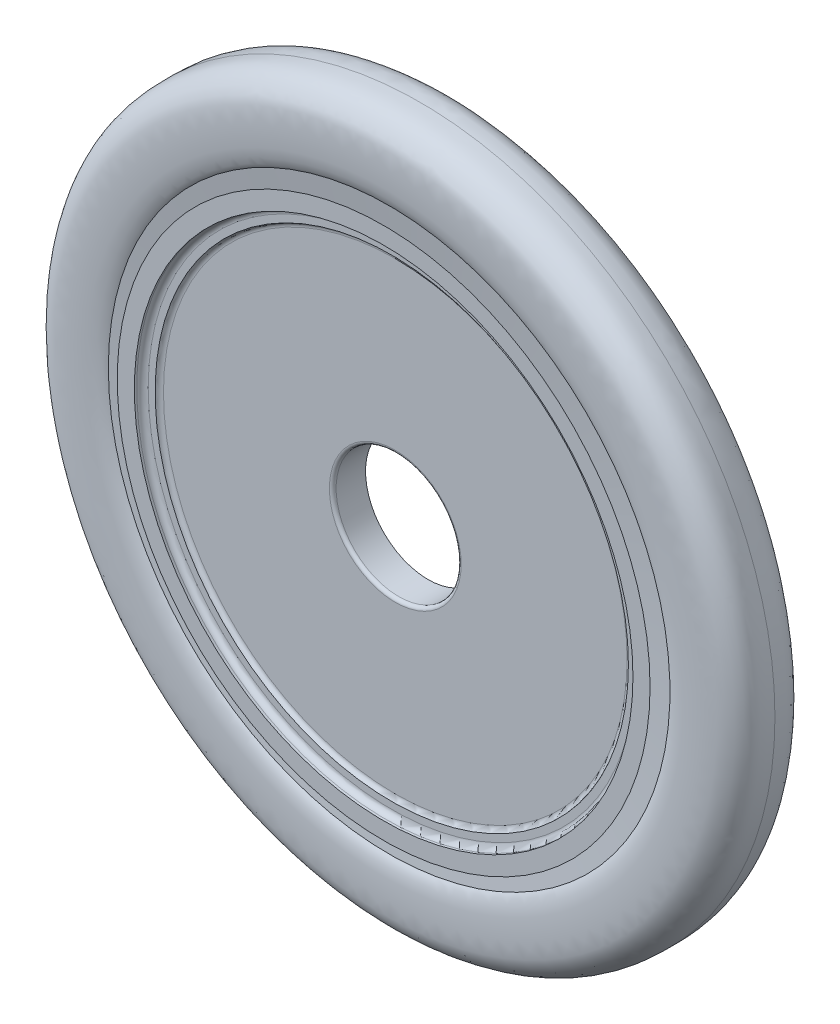
from build123d import *

# Parameters (mm, degrees)
SKETCH1_R                 = 279.4
EXTRUDE1_DEPTH            = 54.61
SKETCH2_R                 = 46.99
CUT_EXTRUDE1_DEPTH        = 399.887167129
SKETCH3_R                 = 187.325
CUT_EXTRUDE2_DEPTH        = 6.096
SKETCH4_R                 = 177.8
CUT_EXTRUDE3_DEPTH        = 2.6416
FILLET6_R                 = 3.81
FILLET7_R                 = 4.318
FILLET8_R                 = 2.54
CUT_EXTRUDE4_START        = -5.9944
SKETCH5_R                 = 187.325
CUT_EXTRUDE4_DEPTH        = 5.9944
FILLET9_R                 = 5.08
SKETCH6_R                 = 176.2125
CUT_EXTRUDE5_DEPTH        = 9.3218
FILLET10_R                = 6.35
SKETCH7_R                 = 76.2
CUT_EXTRUDE6_DEPTH        = 397.538334434
CUT_EXTRUDE7_REACH        = 399.584
SKETCH10_R                = 159.930520618
SKETCH10_R_2              = 68.9991
CUT_EXTRUDE8_DEPTH        = 3.3528
SKETCH15_W                = 18.9992
SKETCH15_H                = 48.261175693
SKETCH15_H_2              = 43.875151213
CUT_EXTRUDE9_DEPTH        = 44.0944
FILLET11_R                = 6.35
CIRPATTERN2_COUNT         = 6
FILLET11_OF_CIRPATTERN2_R = 6.35
SKETCH16_R                = 4.7625
CUT_EXTRUDE10_DEPTH       = 22.86
FILLET12_R                = 6.35
CIRPATTERN3_COUNT         = 6
FILLET12_OF_CIRPATTERN3_R = 6.35


with BuildPart() as part:
    # Sketch1 → Extrude1 (new body)
    with BuildSketch(Plane.XY):
        Circle(SKETCH1_R)
    extrude(amount=EXTRUDE1_DEPTH)

    # Sketch2 → Cut-Extrude1 (cut, through all)
    with BuildSketch(Plane.XY.offset(54.61)):
        Circle(SKETCH2_R)
    extrude(amount=-CUT_EXTRUDE1_DEPTH, mode=Mode.SUBTRACT)

    # Sketch3 → Cut-Extrude2 (cut)
    with BuildSketch(Plane.XY.offset(54.61)):
        Circle(SKETCH3_R)
    extrude(amount=-CUT_EXTRUDE2_DEPTH, mode=Mode.SUBTRACT)

    # Sketch4 → Cut-Extrude3 (cut)
    with BuildSketch(Plane.XY.offset(48.514)):
        Circle(SKETCH4_R)
    extrude(amount=-CUT_EXTRUDE3_DEPTH, mode=Mode.SUBTRACT)

    # Fillet6
    # the kernel refuses this fillet: 3.81 mm, written as the material it adds along each edge
    with BuildSketch(Plane(origin=(0, 0, 45.8724), x_dir=(1, 0, 0), z_dir=(0, -1, 0))) as fillet6_piece_1:
        with BuildLine():
            CenterArc((174.173577322, 3.81), FILLET6_R, 270, 72.141537302)
            Line((177.8, 2.6416), (177.872528454, 2.618232))
            ThreePointArc((177.872528454, 2.618232), (177.8762, 1.3208), (177.8762, 0))
            Line((177.8762, 0), (177.8, -0.0762))
            Line((177.8, -0.0762), (174.173577322, -0.0762))
            Line((174.173577322, -0.0762), (174.173577322, 0))
        make_face()
    revolve(axis=Axis((0, 0, 45.8724), (0, 0, 1)))

    # Fillet7
    fillet7_edges = [part.edges().sort_by_distance(p)[0] for p in [
        (-187.325, 0, 48.514),
    ]]
    fillet(fillet7_edges, radius=FILLET7_R)

    # Fillet8
    fillet8_edges = [part.edges().sort_by_distance(p)[0] for p in [
        (-46.99, 0, 45.8724),
    ]]
    fillet(fillet8_edges, radius=FILLET8_R)

    # Sketch5 → Cut-Extrude4 (cut)
    with BuildSketch(Plane(origin=(0, 0, 0), x_dir=(-1, 0, 0), z_dir=(0, 0, -1)).offset(CUT_EXTRUDE4_START)):
        with Locations(Location((0, 0, 0), (0, 0, 180))):
            Circle(SKETCH5_R)
    extrude(amount=CUT_EXTRUDE4_DEPTH, mode=Mode.SUBTRACT)

    # Fillet9
    fillet9_edges = [part.edges().sort_by_distance(p)[0] for p in [
        (-187.325, 0, 5.9944),
    ]]
    fillet(fillet9_edges, radius=FILLET9_R)

    # Sketch6 → Cut-Extrude5 (cut)
    with BuildSketch(Plane(origin=(0, 0, 5.9944), x_dir=(-1, 0, 0), z_dir=(0, 0, -1))):
        Circle(SKETCH6_R)
    extrude(amount=-CUT_EXTRUDE5_DEPTH, mode=Mode.SUBTRACT)

    # Fillet10
    fillet10_edges = [part.edges().sort_by_distance(p)[0] for p in [
        (176.2125, 0, 5.9944),
    ]]
    fillet(fillet10_edges, radius=FILLET10_R)

    # Sketch7 → Cut-Extrude6 (cut, through all)
    with BuildSketch(Plane.XY.offset(21.2344)):
        Circle(SKETCH7_R)
    extrude(amount=-CUT_EXTRUDE6_DEPTH, mode=Mode.SUBTRACT)

    # Sketch9 → Cut-Extrude7 (cut, up to next)
    with BuildSketch(Plane.XY.offset(44.0944), mode=Mode.PRIVATE) as cut_extrude7_sk1:
        with BuildLine():
            Line((-11.43, 74.173762619), (-11.43, 159.521555048))
            ThreePointArc((-11.43, 159.521555048), (-13.991378978, 165.220217467), (-19.953557312, 167.087794813))
            ThreePointArc((-19.953557312, 167.087794813), (-84.1375, 145.730424822), (-134.725496315, 100.824184935))
            ThreePointArc((-134.725496315, 100.824184935), (-136.089216056, 94.726998363), (-132.434719123, 89.659447889))
            Line((-132.434719123, 89.659447889), (-58.521362722, 46.985551675))
            ThreePointArc((-58.521362722, 46.985551675), (-53.67746857, 46.0351313), (-49.267446033, 48.252857764))
            ThreePointArc((-49.267446033, 48.252857764), (-34.4805, 59.72197787), (-17.154477612, 66.793288726))
            ThreePointArc((-17.154477612, 66.793288726), (-13.028858887, 69.503617043), (-11.43, 74.173762619))
        make_face()
    cut_extrude7_tool1 = extrude(cut_extrude7_sk1.sketch, amount=-CUT_EXTRUDE7_REACH, mode=Mode.PRIVATE) & part.part
    # Sketch9 → Cut-Extrude7 (cut, up to next)
    with BuildSketch(Plane.XY.offset(44.0944), mode=Mode.PRIVATE) as cut_extrude7_sk2:
        with BuildLine():
            Line((11.43, 74.173762619), (11.43, 159.521555048))
            ThreePointArc((11.43, 159.521555048), (13.991378978, 165.220217467), (19.953557312, 167.087794813))
            ThreePointArc((19.953557312, 167.087794813), (84.1375, 145.730424822), (134.725496315, 100.824184935))
            ThreePointArc((134.725496315, 100.824184935), (136.089216056, 94.726998363), (132.434719123, 89.659447889))
            Line((132.434719123, 89.659447889), (58.521362722, 46.985551675))
            ThreePointArc((58.521362722, 46.985551675), (53.67746857, 46.0351313), (49.267446033, 48.252857764))
            ThreePointArc((49.267446033, 48.252857764), (34.4805, 59.72197787), (17.154477612, 66.793288726))
            ThreePointArc((17.154477612, 66.793288726), (13.028858887, 69.503617043), (11.43, 74.173762619))
        make_face()
    cut_extrude7_tool2 = extrude(cut_extrude7_sk2.sketch, amount=-CUT_EXTRUDE7_REACH, mode=Mode.PRIVATE) & part.part
    # Sketch9 → Cut-Extrude7 (cut, up to next)
    with BuildSketch(Plane.XY.offset(44.0944), mode=Mode.PRIVATE) as cut_extrude7_sk3:
        with BuildLine():
            Line((69.951362722, 27.188210944), (143.864719123, 69.862107159))
            ThreePointArc((143.864719123, 69.862107159), (150.080595034, 70.493219104), (154.679053627, 66.263609878))
            ThreePointArc((154.679053627, 66.263609878), (168.275, 0), (154.679053627, -66.263609878))
            ThreePointArc((154.679053627, -66.263609878), (150.080595034, -70.493219104), (143.864719123, -69.862107159))
            Line((143.864719123, -69.862107159), (69.951362722, -27.188210944))
            ThreePointArc((69.951362722, -27.188210944), (66.706327457, -23.468485743), (66.421923645, -18.540430963))
            ThreePointArc((66.421923645, -18.540430963), (68.961, 0), (66.421923645, 18.540430963))
            ThreePointArc((66.421923645, 18.540430963), (66.706327457, 23.468485743), (69.951362722, 27.188210944))
        make_face()
    cut_extrude7_tool3 = extrude(cut_extrude7_sk3.sketch, amount=-CUT_EXTRUDE7_REACH, mode=Mode.PRIVATE) & part.part
    # Sketch9 → Cut-Extrude7 (cut, up to next)
    with BuildSketch(Plane.XY.offset(44.0944), mode=Mode.PRIVATE) as cut_extrude7_sk4:
        with BuildLine():
            Line((58.521362722, -46.985551675), (132.434719123, -89.659447889))
            ThreePointArc((132.434719123, -89.659447889), (136.089216056, -94.726998363), (134.725496315, -100.824184935))
            ThreePointArc((134.725496315, -100.824184935), (84.1375, -145.730424822), (19.953557312, -167.087794813))
            ThreePointArc((19.953557312, -167.087794813), (13.991378978, -165.220217467), (11.43, -159.521555048))
            Line((11.43, -159.521555048), (11.43, -74.173762619))
            ThreePointArc((11.43, -74.173762619), (13.028858887, -69.503617043), (17.154477612, -66.793288726))
            ThreePointArc((17.154477612, -66.793288726), (34.4805, -59.72197787), (49.267446033, -48.252857764))
            ThreePointArc((49.267446033, -48.252857764), (53.67746857, -46.0351313), (58.521362722, -46.985551675))
        make_face()
    cut_extrude7_tool4 = extrude(cut_extrude7_sk4.sketch, amount=-CUT_EXTRUDE7_REACH, mode=Mode.PRIVATE) & part.part
    # Sketch9 → Cut-Extrude7 (cut, up to next)
    with BuildSketch(Plane.XY.offset(44.0944), mode=Mode.PRIVATE) as cut_extrude7_sk5:
        with BuildLine():
            Line((-11.43, -74.173762619), (-11.43, -159.521555048))
            ThreePointArc((-11.43, -159.521555048), (-13.991378978, -165.220217467), (-19.953557312, -167.087794813))
            ThreePointArc((-19.953557312, -167.087794813), (-84.1375, -145.730424822), (-134.725496315, -100.824184935))
            ThreePointArc((-134.725496315, -100.824184935), (-136.089216056, -94.726998363), (-132.434719123, -89.659447889))
            Line((-132.434719123, -89.659447889), (-58.521362722, -46.985551675))
            ThreePointArc((-58.521362722, -46.985551675), (-53.67746857, -46.0351313), (-49.267446033, -48.252857764))
            ThreePointArc((-49.267446033, -48.252857764), (-34.4805, -59.72197787), (-17.154477612, -66.793288726))
            ThreePointArc((-17.154477612, -66.793288726), (-13.028858887, -69.503617043), (-11.43, -74.173762619))
        make_face()
    cut_extrude7_tool5 = extrude(cut_extrude7_sk5.sketch, amount=-CUT_EXTRUDE7_REACH, mode=Mode.PRIVATE) & part.part
    # Sketch9 → Cut-Extrude7 (cut, up to next)
    with BuildSketch(Plane.XY.offset(44.0944), mode=Mode.PRIVATE) as cut_extrude7_sk6:
        with BuildLine():
            Line((-69.951362722, -27.188210944), (-143.864719123, -69.862107159))
            ThreePointArc((-143.864719123, -69.862107159), (-150.080595034, -70.493219104), (-154.679053627, -66.263609878))
            ThreePointArc((-154.679053627, -66.263609878), (-168.275, 0), (-154.679053627, 66.263609878))
            ThreePointArc((-154.679053627, 66.263609878), (-150.080595034, 70.493219104), (-143.864719123, 69.862107159))
            Line((-143.864719123, 69.862107159), (-69.951362722, 27.188210944))
            ThreePointArc((-69.951362722, 27.188210944), (-66.706327457, 23.468485743), (-66.421923645, 18.540430963))
            ThreePointArc((-66.421923645, 18.540430963), (-68.961, 0), (-66.421923645, -18.540430963))
            ThreePointArc((-66.421923645, -18.540430963), (-66.706327457, -23.468485743), (-69.951362722, -27.188210944))
        make_face()
    cut_extrude7_tool6 = extrude(cut_extrude7_sk6.sketch, amount=-CUT_EXTRUDE7_REACH, mode=Mode.PRIVATE) & part.part
    add(cut_extrude7_tool1.solids().sort_by_distance((-61.581371, 106.662063, 44.0944))[0], mode=Mode.SUBTRACT)
    add(cut_extrude7_tool2.solids().sort_by_distance((61.581371, 106.662063, 44.0944))[0], mode=Mode.SUBTRACT)
    add(cut_extrude7_tool3.solids().sort_by_distance((123.162741, 0, 44.0944))[0], mode=Mode.SUBTRACT)
    add(cut_extrude7_tool4.solids().sort_by_distance((61.581371, -106.662063, 44.0944))[0], mode=Mode.SUBTRACT)
    add(cut_extrude7_tool5.solids().sort_by_distance((-61.581371, -106.662063, 44.0944))[0], mode=Mode.SUBTRACT)
    add(cut_extrude7_tool6.solids().sort_by_distance((-123.162741, 0, 44.0944))[0], mode=Mode.SUBTRACT)

    # Sketch10 → Cut-Extrude8 (cut)
    with BuildSketch(Plane(origin=(0, 0, 21.2344), x_dir=(-1, 0, 0), z_dir=(0, 0, -1))):
        Circle(SKETCH10_R)
        Circle(SKETCH10_R_2, mode=Mode.SUBTRACT)
    extrude(amount=-CUT_EXTRUDE8_DEPTH, mode=Mode.SUBTRACT)

    # Sketch13 → Cut-Revolve3 (revolve, cut)
    with BuildSketch(Plane(origin=(0, 0, 0), x_dir=(0, 0, -1), z_dir=(1, 0, 0)), mode=Mode.PRIVATE) as cut_revolve3_sk:
        Polygon((-24.5872, 68.9991), (-32.5628, 169.266397065), (37.50626542, 169.266397065), (37.50626542, 68.9991), align=None)
    revolve(cut_revolve3_sk.sketch.rotate(Axis((0, 0, -70), (0, 0, 1)), 90), axis=Axis((0, 0, -70), (0, 0, 1)), mode=Mode.SUBTRACT)

    # Sketch14 → Cut-Revolve4 (revolve, cut)
    with BuildSketch(Plane(origin=(0, 0, 0), x_dir=(0, 0, -1), z_dir=(1, 0, 0)), mode=Mode.PRIVATE) as cut_revolve4_sk:
        with BuildLine():
            Line((-52.704368182, 190.711903868), (-47.941868182, 190.711903868))
            Line((-47.941868182, 190.711903868), (-50.488984721, 210.994957868))
            add(Edge.make_bspline(
                [(-50.488984721, 210.994957868), (-50.893048612, 211.577643231), (-51.297112503, 212.160328595), (-52.099842783, 213.692885843), (-52.770671521, 215.844089414), (-53.334394455, 217.996838391), (-54.047257666, 221.502508464), (-54.264651136, 223.89435848), (-54.540955451, 229.193702536), (-54.592289836, 232.065674754), (-54.592289836, 239.081141305), (-54.483996644, 243.048991001), (-53.811874321, 249.66239506), (-52.844332886, 253.025558903), (-49.955365165, 257.850761665), (-47.072994134, 261.511417731), (-42.412760175, 264.946227504), (-37.894279577, 266.323460572), (-33.874082267, 266.601921336), (-30.752293145, 266.711318619), (-28.550061812, 266.704087955), (-27.305, 266.7)],
                knots=[0, 0, 0, 0, 0.028977325, 0.028977325, 0.07130688, 0.120462309, 0.120462309, 0.218453151, 0.218453151, 0.337934113, 0.337934113, 0.50301953, 0.50301953, 0.603469735, 0.644828209, 0.7275487, 0.788818573, 0.874448816, 0.912385929, 0.950466179, 1, 1, 1, 1], degree=3))
            add(Edge.make_bspline(
                [(-4.121015279, 210.994957868), (-3.716951388, 211.577643231), (-3.312887497, 212.160328595), (-2.510157217, 213.692885843), (-1.839328479, 215.844089414), (-1.275605545, 217.996838391), (-0.562742334, 221.502508464), (-0.345348864, 223.89435848), (-0.069044549, 229.193702536), (-0.017710164, 232.065674754), (-0.017710164, 239.081141305), (-0.126003356, 243.048991001), (-0.798125679, 249.66239506), (-1.765667114, 253.025558903), (-4.654634835, 257.850761665), (-7.537005866, 261.511417731), (-12.197239825, 264.946227504), (-16.715720423, 266.323460572), (-20.735917733, 266.601921336), (-23.857706855, 266.711318619), (-26.059938188, 266.704087955), (-27.305, 266.7)],
                knots=[0, 0, 0, 0, 0.028977325, 0.028977325, 0.07130688, 0.120462309, 0.120462309, 0.218453151, 0.218453151, 0.337934113, 0.337934113, 0.50301953, 0.50301953, 0.603469735, 0.644828209, 0.7275487, 0.788818573, 0.874448816, 0.912385929, 0.950466179, 1, 1, 1, 1], degree=3))
            Line((-4.121015279, 210.994957868), (-6.668131818, 190.711903868))
            Line((-6.668131818, 190.711903868), (-1.905631818, 190.711903868))
            Line((-1.905631818, 190.711903868), (18.933198197, 238.989099471))
            Line((18.933198197, 238.989099471), (2.878088343, 283.397614778))
            Line((2.878088343, 283.397614778), (-55.623629315, 283.397614778))
            Line((-55.623629315, 283.397614778), (-66.153121314, 257.524623221))
            Line((-66.153121314, 257.524623221), (-52.704368182, 190.711903868))
        make_face()
    revolve(cut_revolve4_sk.sketch.rotate(Axis((0, 0, -129.126974732), (0, 0, 1)), 90), axis=Axis((0, 0, -129.126974732), (0, 0, 1)), mode=Mode.SUBTRACT)

    # Sketch15 → Cut-Extrude9 (cut)
    with BuildSketch(Plane.XY):
        with Locations((0, -97.303659352)):
            Rectangle(SKETCH15_W, SKETCH15_H)
        with Locations((0, -145.403822805)):
            Rectangle(SKETCH15_W, SKETCH15_H_2)
    cut_extrude9 = extrude(amount=CUT_EXTRUDE9_DEPTH, mode=Mode.SUBTRACT)

    # Fillet11
    fillet11_edges = [part.edges().sort_by_distance(p)[0] for p in [
        (9.4996, -167.341398411, 38.262754786),
        (9.4996, -123.466247198, 36.521563837),
        (-9.4996, -123.466247198, 36.521563837),
        (-9.4996, -167.341398411, 38.262754786),
        (-9.4996, -121.434247198, 36.440989882),
        (9.4996, -121.434247198, 36.440989882),
        (-9.4996, -73.173071505, 34.531228116),
        (9.4996, -73.173071505, 34.531228116),
    ]]
    fillet(fillet11_edges, radius=FILLET11_R)

    # CirPattern2: Cut-Extrude9 ×6 about axis
    cirpattern2_axis = Axis((0, 0, 0), (0, 0, 1))
    for i in range(1, CIRPATTERN2_COUNT):
        add(cut_extrude9.rotate(cirpattern2_axis, i * 360 / CIRPATTERN2_COUNT), mode=Mode.SUBTRACT)

    # Fillet11 of CirPattern2
    fillet11_of_cirpattern2_edges = [part.edges().sort_by_distance(p)[0] for p in [
        (149.671702128, -75.44380428, 38.262754786),
        (111.674706584, -53.506228673, 36.521563837),
        (102.175106584, -69.960018525, 36.521563837),
        (140.172102128, -91.897594131, 38.262754786),
        (100.415342963, -68.944018525, 36.440989882),
        (109.914942963, -52.490228673, 36.440989882),
        (58.619938796, -44.813430678, 34.531228116),
        (68.119538796, -28.359640827, 34.531228116),
        (140.172102128, 91.897594131, 38.262754786),
        (102.175106584, 69.960018525, 36.521563837),
        (111.674706584, 53.506228673, 36.521563837),
        (149.671702128, 75.44380428, 38.262754786),
        (109.914942963, 52.490228673, 36.440989882),
        (100.415342963, 68.944018525, 36.440989882),
        (68.119538796, 28.359640827, 34.531228116),
        (58.619938796, 44.813430678, 34.531228116),
        (-9.4996, 167.341398411, 38.262754786),
        (-9.4996, 123.466247198, 36.521563837),
        (9.4996, 123.466247198, 36.521563837),
        (9.4996, 167.341398411, 38.262754786),
        (9.4996, 121.434247198, 36.440989882),
        (-9.4996, 121.434247198, 36.440989882),
        (9.4996, 73.173071505, 34.531228116),
        (-9.4996, 73.173071505, 34.531228116),
        (-149.671702128, 75.44380428, 38.262754786),
        (-111.674706584, 53.506228673, 36.521563837),
        (-102.175106584, 69.960018525, 36.521563837),
        (-140.172102128, 91.897594131, 38.262754786),
        (-100.415342963, 68.944018525, 36.440989882),
        (-109.914942963, 52.490228673, 36.440989882),
        (-58.619938796, 44.813430678, 34.531228116),
        (-68.119538796, 28.359640827, 34.531228116),
        (-140.172102128, -91.897594131, 38.262754786),
        (-102.175106584, -69.960018525, 36.521563837),
        (-111.674706584, -53.506228673, 36.521563837),
        (-149.671702128, -75.44380428, 38.262754786),
        (-109.914942963, -52.490228673, 36.440989882),
        (-100.415342963, -68.944018525, 36.440989882),
        (-68.119538796, -28.359640827, 34.531228116),
        (-58.619938796, -44.813430678, 34.531228116),
    ]]
    fillet(fillet11_of_cirpattern2_edges, radius=FILLET11_OF_CIRPATTERN2_R)

    # Sketch16 → Cut-Extrude10 (cut)
    with BuildSketch(Plane(origin=(0, 0, 21.2344), x_dir=(-1, 0, 0), z_dir=(0, 0, -1))):
        with Locations((0, 57.9882)):
            Circle(SKETCH16_R)
        with BuildLine():
            Line((10.720254078, 48.355941233), (14.376135597, 64.846557089))
            ThreePointArc((14.376135597, 64.846557089), (33.2105, 57.522273345), (48.970697988, 44.87337718))
            Line((48.970697988, 44.87337718), (36.517346492, 33.461982983))
            ThreePointArc((36.517346492, 33.461982983), (24.765, 42.894238249), (10.720254078, 48.355941233))
        make_face()
    cut_extrude10 = extrude(amount=-CUT_EXTRUDE10_DEPTH, mode=Mode.SUBTRACT)

    # Fillet12
    fillet12_edges = [part.edges().sort_by_distance(p)[0] for p in [
        (-10.720254078, 48.355941233, 32.6644),
        (-36.517346492, 33.461982983, 32.6644),
        (-48.970697988, 44.87337718, 32.6644),
        (-14.376135597, 64.846557089, 32.6644),
    ]]
    fillet(fillet12_edges, radius=FILLET12_R)

    # CirPattern3: Cut-Extrude10 ×6 about axis
    cirpattern3_axis = Axis((0, 0, 0), (0, 0, 1))
    for i in range(1, CIRPATTERN3_COUNT):
        add(cut_extrude10.rotate(cirpattern3_axis, i * 360 / CIRPATTERN3_COUNT), mode=Mode.SUBTRACT)

    # Fillet12 of CirPattern3
    fillet12_of_cirpattern3_edges = [part.edges().sort_by_distance(p)[0] for p in [
        (-47.237600571, 14.893958249, 32.6644),
        (-47.237600571, -14.893958249, 32.6644),
        (-63.346833586, -19.973179909, 32.6644),
        (-63.346833586, 19.973179909, 32.6644),
        (-36.517346492, -33.461982983, 32.6644),
        (-10.720254078, -48.355941233, 32.6644),
        (-14.376135597, -64.846557089, 32.6644),
        (-48.970697988, -44.87337718, 32.6644),
        (10.720254078, -48.355941233, 32.6644),
        (36.517346492, -33.461982983, 32.6644),
        (48.970697988, -44.87337718, 32.6644),
        (14.376135597, -64.846557089, 32.6644),
        (47.237600571, -14.893958249, 32.6644),
        (47.237600571, 14.893958249, 32.6644),
        (63.346833586, 19.973179909, 32.6644),
        (63.346833586, -19.973179909, 32.6644),
        (36.517346492, 33.461982983, 32.6644),
        (10.720254078, 48.355941233, 32.6644),
        (14.376135597, 64.846557089, 32.6644),
        (48.970697988, 44.87337718, 32.6644),
    ]]
    fillet(fillet12_of_cirpattern3_edges, radius=FILLET12_OF_CIRPATTERN3_R)


solid = part.part
